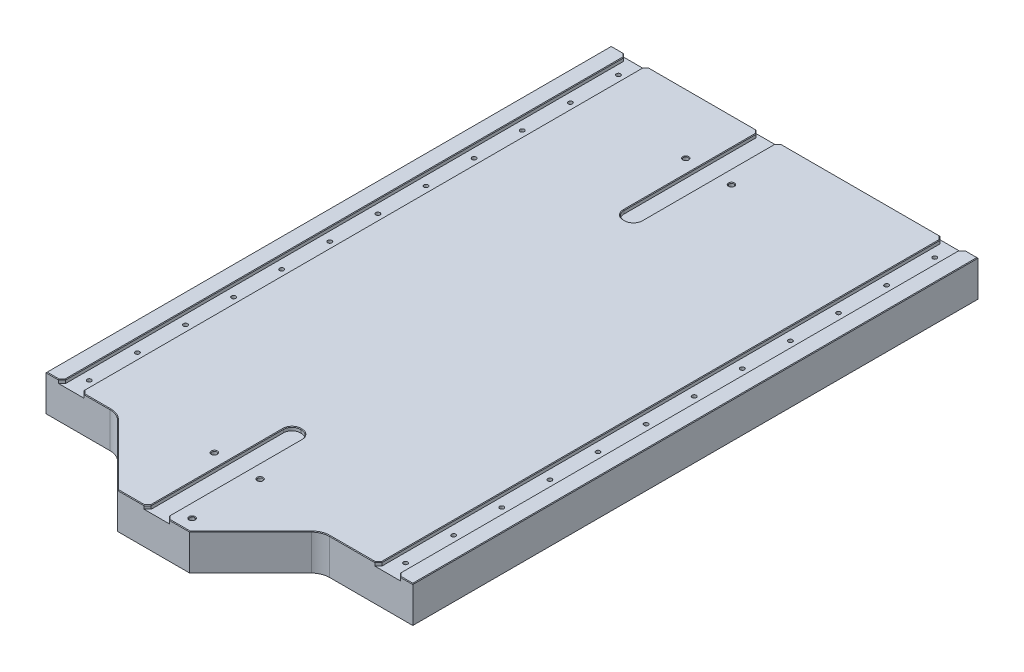
from build123d import *

# Parameters (mm, degrees)
BOSS_EXTRUDE1_DEPTH = 30
SKETCH2_R           = 1.75
SKETCH2_R_2         = 2
CUT_EXTRUDE1_DEPTH  = 330.023175476
SKETCH3_W           = 15.25
SKETCH3_H           = 470
CUT_EXTRUDE2_DEPTH  = 3
SKETCH4_W           = 15
SKETCH4_H           = 120
CUT_EXTRUDE3_DEPTH  = 3
FILLET1_R           = 7
FILLET2_R           = 15
CHAMFER1_SIZE       = 3
CHAMFER2_SIZE       = 0.5


with BuildPart() as part:
    # Sketch1 → Boss-Extrude1 (new body)
    with BuildSketch(Plane(origin=(0, 0, 0), x_dir=(1, 0, 0), z_dir=(0, 1, 0))):
        Polygon((-93, -235), (-38, -290), (22, -290), (77, -235), (152.5, -235), (152.5, 235), (-152.5, 235), (-152.5, -235), align=None)
    extrude(amount=BOSS_EXTRUDE1_DEPTH)

    # Sketch2 → Cut-Extrude1 (cut, through all)
    with BuildSketch(Plane(origin=(0, 0, 0), x_dir=(1, 0, 0), z_dir=(0, 1, 0))):
        with Locations((-131.5, 220)):
            Circle(SKETCH2_R)
        with Locations((131.5, 220)):
            Circle(SKETCH2_R)
        with Locations((13.5, -223)):
            Circle(SKETCH2_R_2)
        with Locations((-24.5, -223)):
            Circle(SKETCH2_R_2)
        with Locations((-40.5, 185)):
            Circle(SKETCH2_R_2)
        with Locations((-2.5, 185)):
            Circle(SKETCH2_R_2)
        with Locations((-131.5, 180)):
            Circle(SKETCH2_R)
        with Locations((131.5, 180)):
            Circle(SKETCH2_R)
        with Locations((-131.5, 140)):
            Circle(SKETCH2_R)
        with Locations((131.5, 140)):
            Circle(SKETCH2_R)
        with Locations((-131.5, 100)):
            Circle(SKETCH2_R)
        with Locations((131.5, 100)):
            Circle(SKETCH2_R)
        with Locations((-131.5, 60)):
            Circle(SKETCH2_R)
        with Locations((131.5, 60)):
            Circle(SKETCH2_R)
        with Locations((-131.5, 20)):
            Circle(SKETCH2_R)
        with Locations((131.5, 20)):
            Circle(SKETCH2_R)
        with Locations((-131.5, -20)):
            Circle(SKETCH2_R)
        with Locations((131.5, -20)):
            Circle(SKETCH2_R)
        with Locations((-131.5, -60)):
            Circle(SKETCH2_R)
        with Locations((131.5, -60)):
            Circle(SKETCH2_R)
        with Locations((-131.5, -100)):
            Circle(SKETCH2_R)
        with Locations((131.5, -100)):
            Circle(SKETCH2_R)
        with Locations((-131.5, -140)):
            Circle(SKETCH2_R)
        with Locations((131.5, -140)):
            Circle(SKETCH2_R)
        with Locations((-131.5, -180)):
            Circle(SKETCH2_R)
        with Locations((131.5, -180)):
            Circle(SKETCH2_R)
        with Locations((-131.5, -220)):
            Circle(SKETCH2_R)
        with Locations((131.5, -220)):
            Circle(SKETCH2_R)
        with Locations((13.5, -279.5)):
            Circle(SKETCH2_R_2)
    extrude(amount=CUT_EXTRUDE1_DEPTH, mode=Mode.SUBTRACT)

    # Sketch3 → Cut-Extrude2 (cut)
    with BuildSketch(Plane(origin=(0, 30, 0), x_dir=(1, 0, 0), z_dir=(0, 1, 0))):
        with Locations((-131.5, 0)):
            Rectangle(SKETCH3_W, SKETCH3_H)
        with Locations((131.5, 0)):
            Rectangle(SKETCH3_W, SKETCH3_H)
    extrude(amount=-CUT_EXTRUDE2_DEPTH, mode=Mode.SUBTRACT)

    # Sketch4 → Cut-Extrude3 (cut)
    with BuildSketch(Plane(origin=(0, 30, 0), x_dir=(1, 0, 0), z_dir=(0, 1, 0))):
        with Locations((-5.5, -230)):
            Rectangle(SKETCH4_W, SKETCH4_H)
        with Locations((-21.5, 175)):
            Rectangle(SKETCH4_W, SKETCH4_H)
    extrude(amount=-CUT_EXTRUDE3_DEPTH, mode=Mode.SUBTRACT)

    # Fillet1
    fillet1_edges = [part.edges().sort_by_distance(p)[0] for p in [
        (-29, 28.5, -115),
        (-14, 28.5, -115),
        (-13, 28.5, 170),
        (2, 28.5, 170),
    ]]
    fillet(fillet1_edges, radius=FILLET1_R)

    # Fillet2
    fillet2_edges = [part.edges().sort_by_distance(p)[0] for p in [
        (77, 15, 235),
        (-93, 15, 235),
    ]]
    fillet(fillet2_edges, radius=FILLET2_R)

    # Chamfer1
    chamfer1_edges = [part.edges().sort_by_distance(p)[0] for p in [
        (-139.125, 28.5, 235),
        (-123.875, 28.5, 235),
        (139.125, 28.5, 235),
        (123.875, 28.5, 235),
        (139.125, 28.5, -235),
        (123.875, 28.5, -235),
        (-123.875, 28.5, -235),
        (-139.125, 28.5, -235),
        (-14, 28.5, -235),
        (-29, 28.5, -235),
        (2, 28.5, 290),
        (-13, 28.5, 290),
    ]]
    chamfer(chamfer1_edges, length=CHAMFER1_SIZE)

    # Chamfer2
    chamfer2_edges = [part.edges().sort_by_distance(p)[0] for p in [
        (140.625, 30, -233.5),
        (147.3125, 30, -235),
        (152.5, 30, 0),
        (147.3125, 30, 235),
        (140.625, 30, 233.5),
        (139.125, 30, 0),
        (-122.375, 30, -233.5),
        (-76.4375, 30, -235),
        (-30.5, 30, -233.5),
        (-29, 30, -177),
        (-26.949747468, 30, -117.050252532),
        (-21.5, 30, -115),
        (-16.050252532, 30, -117.050252532),
        (-14, 30, -177),
        (-12.5, 30, -233.5),
        (54.9375, 30, -235),
        (122.375, 30, -233.5),
        (123.875, 30, 0),
        (122.375, 30, 233.5),
        (102.044101718, 30, 235),
        (77.47295195, 30, 236.141807012),
        (47.303300859, 30, 264.696699141),
        (13.5, 30, 290),
        (3.5, 30, 288.5),
        (2, 30, 232),
        (-0.050252532, 30, 172.050252532),
        (-5.5, 30, 170),
        (-10.949747468, 30, 172.050252532),
        (-13, 30, 232),
        (-14.5, 30, 288.5),
        (-27, 30, 290),
        (-63.303300859, 30, 264.696699141),
        (-93.47295195, 30, 236.141807012),
        (-110.044101718, 30, 235),
        (-122.375, 30, 233.5),
        (-123.875, 30, 0),
        (11.5, 30, 279.5),
        (-4.5, 30, -185),
        (-42.5, 30, -185),
        (-26.5, 30, 223),
        (11.5, 30, 223),
        (-152.5, 30, 0),
        (-147.3125, 30, -235),
        (-140.625, 30, -233.5),
        (-139.125, 30, 0),
        (-140.625, 30, 233.5),
        (-147.3125, 30, 235),
    ]]
    chamfer(chamfer2_edges, length=CHAMFER2_SIZE)


solid = part.part
